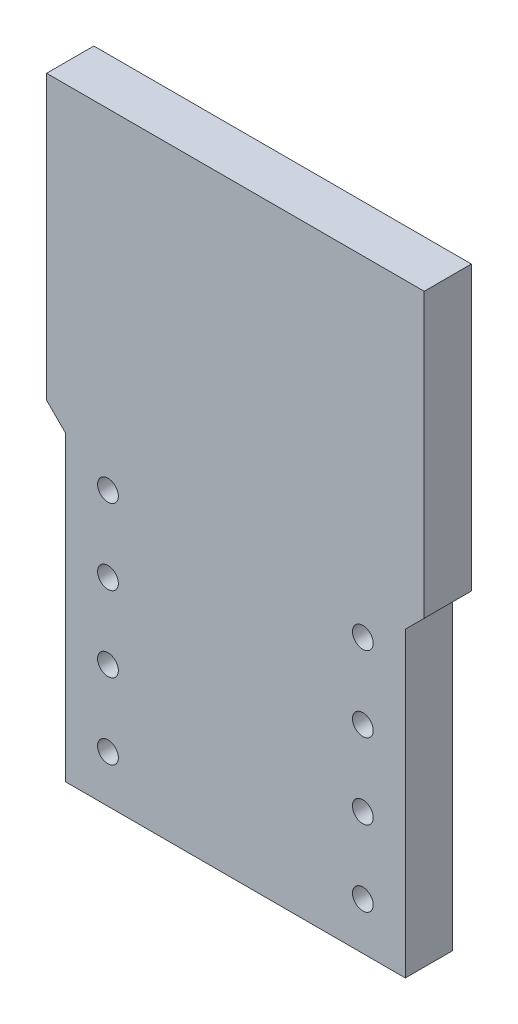
from build123d import *

# Parameters (mm, degrees)
CROQUIS1_R              = 1.1
SALIENTE_EXTRUIR1_DEPTH = 5


with BuildPart() as part:
    # Croquis1 → Saliente-Extruir1 (new body)
    with BuildSketch(Plane.XY):
        Polygon((20, 15), (-20, 15), (-20, -15), (-18, -17), (-18, -49), (18, -49), (18, -17), (20, -15), align=None)
        with Locations((13.5, -28)):
            Circle(CROQUIS1_R, mode=Mode.SUBTRACT)
        with Locations((13.5, -20)):
            Circle(CROQUIS1_R, mode=Mode.SUBTRACT)
        with Locations((13.5, -44)):
            Circle(CROQUIS1_R, mode=Mode.SUBTRACT)
        with Locations((13.5, -36)):
            Circle(CROQUIS1_R, mode=Mode.SUBTRACT)
        with Locations((-13.5, -20)):
            Circle(CROQUIS1_R, mode=Mode.SUBTRACT)
        with Locations((-13.5, -28)):
            Circle(CROQUIS1_R, mode=Mode.SUBTRACT)
        with Locations((-13.5, -44)):
            Circle(CROQUIS1_R, mode=Mode.SUBTRACT)
        with Locations((-13.5, -36)):
            Circle(CROQUIS1_R, mode=Mode.SUBTRACT)
    extrude(amount=SALIENTE_EXTRUIR1_DEPTH)


solid = part.part
